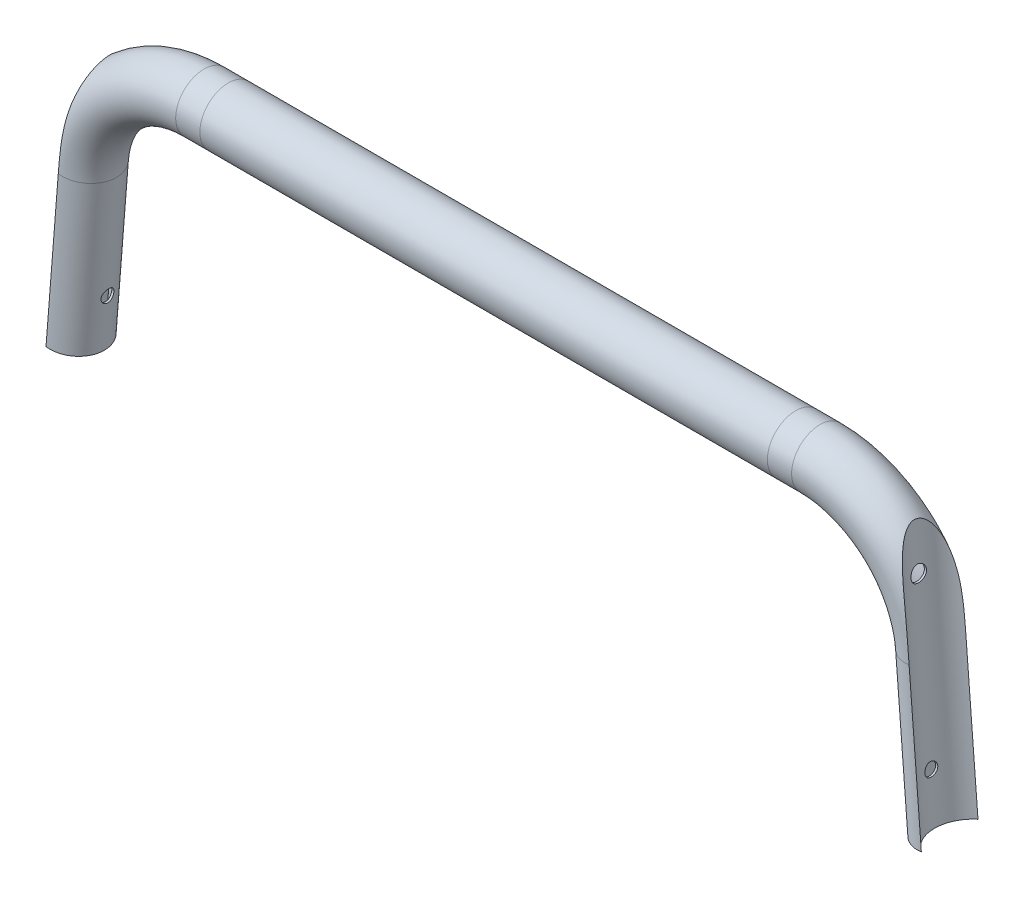
from build123d import *

# Parameters (mm, degrees)
SKETCH2_R               = 11
SKETCH2_R_2             = 10.2
SKETCH3_R               = 13.199999999999989
CUT_EXTRUDE1_DEPTH      = 228.11520508019987
BOSS_EXTRUDE1_REACH     = 220.623
CUT_EXTRUDE2_REACH      = 359.163
CUT_EXTRUDE2_END_RADIUS = 10.999999999999984
SKETCH8_R               = 2.5
CUT_EXTRUDE3_REACH      = 366.624
SKETCH9_R               = 3.0000000000000013


with BuildPart() as part:
    # Sweep1: sweep along a path in Sketch1
    with BuildLine(Plane.XY) as sweep1_path:
        Line((-169, -101.9), (-164.24400396794306, -41.46934069224714))
        ThreePointArc((-164.24400396794306, -41.46934069224714), (-149.92875749893474, -11.95548707539421), (-119.38272394995231, 0))
        Line((-119.38272394995231, 0), (-110, 1.01e-15))
        Line((-110, 1.01e-15), (110, 1.01e-15))
        Line((110, 1.01e-15), (119.38272394995231, 0))
        ThreePointArc((119.38272394995231, 0), (149.92875749893471, -11.955487075394231), (164.24400396794303, -41.46934069224714))
        Line((164.24400396794303, -41.46934069224714), (169, -101.9))
    # Sketch2 → Sweep1 (sweep)
    with BuildSketch(Plane(origin=(-168.99999999999997, -101.9, 0), x_dir=(-0.9969173337331282, 0.07845909572784168, 0), z_dir=(-0.07845909572784168, -0.9969173337331282, 0))):
        Circle(SKETCH2_R)
        Circle(SKETCH2_R_2, mode=Mode.SUBTRACT)
    sweep(path=sweep1_path.line)

    # Sketch3 → Cut-Extrude1 (cut, through all)
    with BuildSketch(Plane(origin=(9.010671213510205, -114.49143324922126, 0), x_dir=(0.9969173337331282, 0.07845909572784168, 0), z_dir=(0.07845909572784168, -0.9969173337331282, 0))):
        with Locations((168.4840475462316, 0)):
            Circle(SKETCH3_R)
    cut_extrude1 = extrude(amount=-CUT_EXTRUDE1_DEPTH, mode=Mode.SUBTRACT)

    # Mirror1: Cut-Extrude1 across plane
    add(cut_extrude1.mirror(Plane(origin=(0, 0, 0), x_dir=(0, 0, 1), z_dir=(1, 0, 0))), mode=Mode.SUBTRACT)

    # Sketch6 → Boss-Extrude1 (add, up to next)
    with BuildSketch(Plane(origin=(9.010671213510207, -114.49143324922127, 0), x_dir=(0.9969173337331283, 0.07845909572784171, 0), z_dir=(0.07845909572784171, -0.9969173337331283, 0)), mode=Mode.PRIVATE) as boss_extrude1_sk1:
        with BuildLine():
            ThreePointArc((161.6457672642802, 11.290612152823), (155.28404754623162, 1.62e-15), (161.6457672642802, -11.290612152823))
            ThreePointArc((161.6457672642802, -11.290612152823), (160.96663568984565, -11.339956974010994), (160.28576726428025, -11.348488904632488))
            ThreePointArc((160.28576726428025, -11.348488904632488), (154.48404754623164, -1.072e-14), (160.28576726428022, 11.34848890463249))
            ThreePointArc((160.28576726428022, 11.34848890463249), (160.96663568984565, 11.339956974010992), (161.6457672642802, 11.290612152823))
        make_face()
    boss_extrude1_tool1 = extrude(boss_extrude1_sk1.sketch, amount=-BOSS_EXTRUDE1_REACH, mode=Mode.PRIVATE) - part.part
    boss_extrude1 = boss_extrude1_tool1.solids().sort_by_distance((163.57873, -102.326663, 0))[0]
    add(boss_extrude1)

    # Mirror2: Boss-Extrude1 across plane
    add(boss_extrude1.mirror(Plane(origin=(0, 0, 0), x_dir=(0, 0, 1), z_dir=(1, 0, 0))))

    # Cut-Extrude2: up to this cylinder (the profile starts inside it)
    cut_extrude2_end = Plane(origin=(167.50125946871677, -82.85669596311119, 0), z_dir=(0.0784590957278419, -0.9969173337331283, 0)) * Cylinder(CUT_EXTRUDE2_END_RADIUS, 741.326, mode=Mode.PRIVATE)
    # Sketch8 → Cut-Extrude2 (cut, up to the surface)
    with BuildSketch(Plane(origin=(169.00000000000003, -101.9, 0), x_dir=(7.6e-16, 6e-17, -1), z_dir=(0.9969173337331283, 0.0784590957278417, 0)), mode=Mode.PRIVATE) as cut_extrude2_sk1:
        with Locations((0, 19.10218999047264)):
            Circle(SKETCH8_R)
    cut_extrude2_tool1 = extrude(cut_extrude2_sk1.sketch, amount=-CUT_EXTRUDE2_REACH, mode=Mode.PRIVATE) & cut_extrude2_end
    cut_extrude2 = cut_extrude2_tool1.solids().sort_by_distance((167.501259, -82.856696, 0))[0]
    add(cut_extrude2, mode=Mode.SUBTRACT)

    # Mirror3: Cut-Extrude2 across plane
    add(cut_extrude2.mirror(Plane(origin=(0, 0, 0), x_dir=(0, 0, 1), z_dir=(1, 0, 0))), mode=Mode.SUBTRACT)

    # Sketch9 → Cut-Extrude3 (cut, up to next)
    with BuildSketch(Plane(origin=(180, 0, 0), x_dir=(0, 0, -1), z_dir=(1, 0, 0)), mode=Mode.PRIVATE) as cut_extrude3_sk1:
        with Locations((0, -20)):
            Circle(SKETCH9_R)
    cut_extrude3_tool1 = extrude(cut_extrude3_sk1.sketch, amount=-CUT_EXTRUDE3_REACH, mode=Mode.PRIVATE) & part.part
    add(cut_extrude3_tool1.solids().sort_by_distance((180, -20, 0))[0], mode=Mode.SUBTRACT)


solid = part.part
